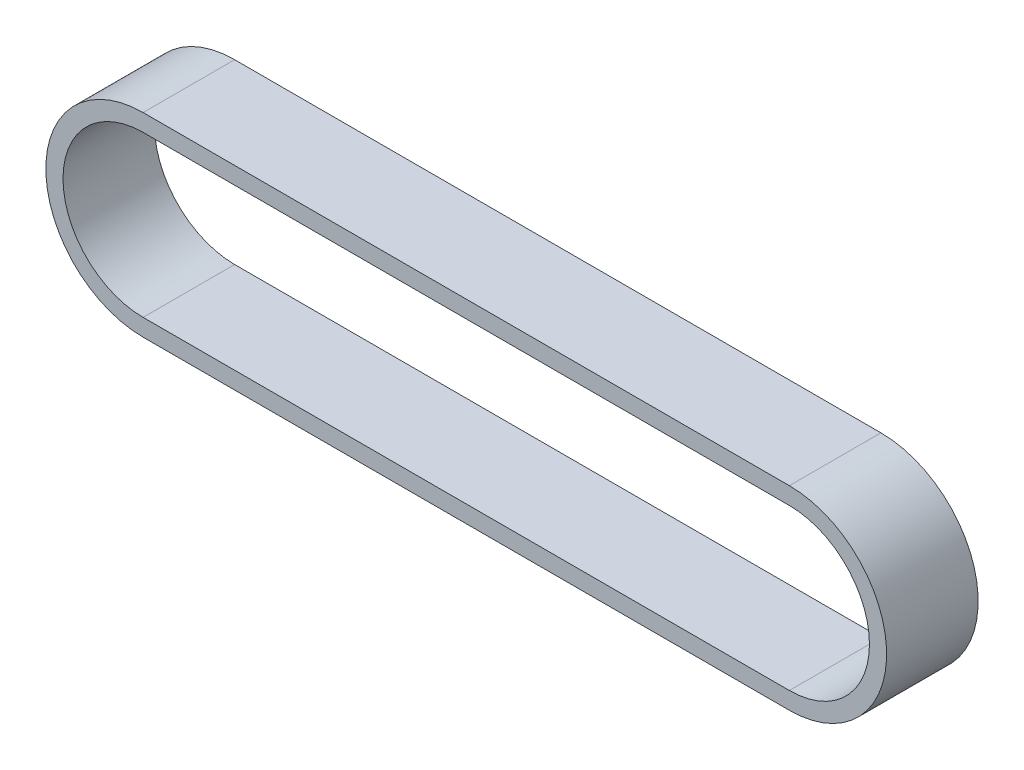
from build123d import *

# Parameters (mm, degrees)
ESTRUSIONE_ESTRUSIONE2_DEPTH = 6.4


with BuildPart() as part:
    # Schizzo1 → Estrusione-Estrusione2 (new body)
    with BuildSketch(Plane.XY):
        with BuildLine():
            Line((-45.177427992, -6.8), (0, -6.8))
            ThreePointArc((0, -6.8), (6.8, 0), (0, 6.8))
            Line((0, 6.8), (-45.177427992, 6.8))
            ThreePointArc((-45.177427992, 6.8), (-51.977427992, 0), (-45.177427992, -6.8))
        make_face()
        with BuildLine():
            ThreePointArc((0, 5.6), (5.6, 0), (0, -5.6))
            Line((0, -5.6), (-45.177427992, -5.6))
            ThreePointArc((-45.177427992, -5.6), (-50.777427992, 0), (-45.177427992, 5.6))
            Line((-45.177427992, 5.6), (0, 5.6))
        make_face(mode=Mode.SUBTRACT)
    extrude(amount=ESTRUSIONE_ESTRUSIONE2_DEPTH)


solid = part.part
